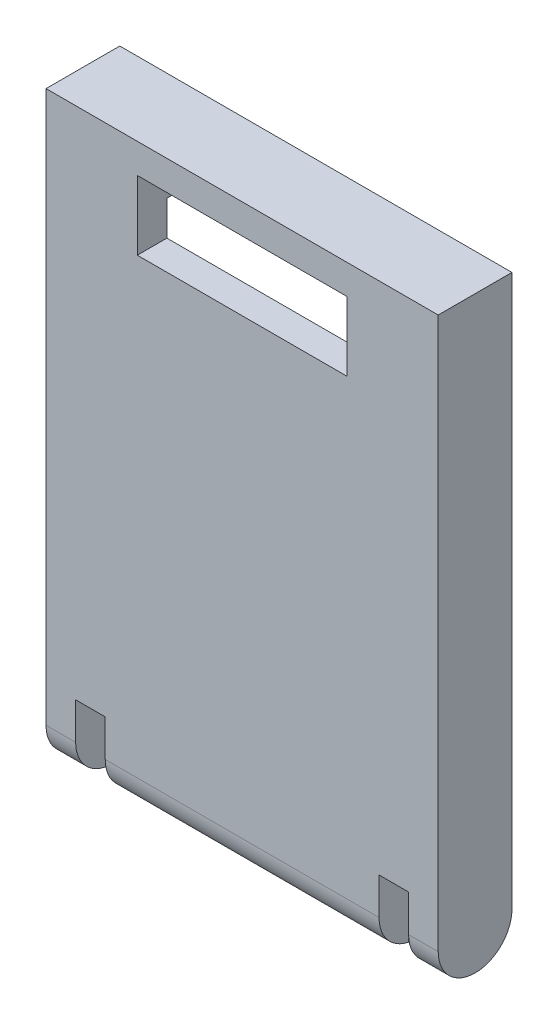
from build123d import *

# Parameters (mm, degrees)
BOSS_EXTRUDE1_DEPTH     = 15.9
SHELL1_START            = -14.7
SHELL1_DEPTH            = 13.5
CUT_EXTRUDE1_DEPTH      = 29.819656487
CUT_EXTRUDE1_DEPTH_BACK = 29.819656487
SKETCH3_W               = 8.5
SKETCH3_H               = 2.8
CUT_EXTRUDE2_START      = -1.2
CUT_EXTRUDE2_DEPTH      = 1.2
LPATTERN1_COUNT         = 2
LPATTERN1_PITCH         = 12.3
SKETCH5_W               = 11.1
SKETCH5_H               = 2.99
CUT_EXTRUDE5_DEPTH      = 0.8
SKETCH6_W               = 8.7
SKETCH6_H               = 0.59
BOSS_EXTRUDE2_DEPTH     = 1.1
SKETCH7_W               = 11.1
SKETCH7_H               = 1.1
CUT_EXTRUDE6_DEPTH      = 0.17
SKETCH8_W               = 0.5
SKETCH8_H               = 1.4
BOSS_EXTRUDE3_DEPTH     = 2.5
LPATTERN2_COUNT         = 2
LPATTERN2_PITCH         = 9


# Read off the part's stored shape, not the designer's step: Shell1
with BuildPart() as part:
    # Sketch2 → Boss-Extrude1 (new body)
    with BuildSketch(Plane(origin=(0, 0, 0), x_dir=(0, 0, -1), z_dir=(1, 0, 0))):
        with BuildLine():
            Line((-1.495, 0), (1.495, 0))
            Line((1.495, 0), (1.495, -22.355))
            ThreePointArc((1.495, -22.355), (0, -23.85), (-1.495, -22.355))
            Line((-1.495, -22.355), (-1.495, 0))
        make_face()
    extrude(amount=-BOSS_EXTRUDE1_DEPTH)

    # Shell1 outline → Shell1 (cut)
    with BuildSketch(Plane.YZ.offset(SHELL1_START)):
        with BuildLine():
            Line((-22.355, -0.295), (-22.355, -1.495))
            Line((-22.355, -1.495), (-1.2, -1.495))
            Line((-1.2, -1.495), (-1.2, 0.295))
            Line((-1.2, 0.295), (-22.355, 0.295))
            ThreePointArc((-22.355, 0.295), (-22.65, 0), (-22.355, -0.295))
        make_face()
    extrude(amount=SHELL1_DEPTH, mode=Mode.SUBTRACT)

    # Sketch3 → Cut-Extrude1 (cut, two sides: drawn at the far end of the back side and taken through both)
    with BuildSketch(Plane.XY.offset(1.495).offset(-CUT_EXTRUDE1_DEPTH_BACK)):
        with Locations((-7.95, -2.6)):
            Rectangle(SKETCH3_W, SKETCH3_H)
    extrude(amount=CUT_EXTRUDE1_DEPTH + CUT_EXTRUDE1_DEPTH_BACK, mode=Mode.SUBTRACT)

    # Sketch4 → Cut-Extrude2 (cut)
    with BuildSketch(Plane.ZY.offset(14.7).offset(CUT_EXTRUDE2_START)):
        with BuildLine():
            Line((1.495, -20.86), (-1.495, -20.86))
            Line((-1.495, -20.86), (-1.495, -22.355))
            ThreePointArc((-1.495, -22.355), (0, -23.85), (1.495, -22.355))
            Line((1.495, -22.355), (1.495, -20.86))
        make_face()
    cut_extrude2 = extrude(amount=CUT_EXTRUDE2_DEPTH, mode=Mode.SUBTRACT)

    # LPattern1: Cut-Extrude2 ×2
    with Locations(*[(i * LPATTERN1_PITCH, 0, 0) for i in range(1, LPATTERN1_COUNT)]):
        add(cut_extrude2, mode=Mode.SUBTRACT)

    # Sketch5 → Cut-Extrude5 (cut)
    with BuildSketch(Plane(origin=(0, 0, -1.495), x_dir=(-1, 0, 0), z_dir=(0, 0, -1))):
        with Locations((7.95, -22.355)):
            Rectangle(SKETCH5_W, SKETCH5_H)
    extrude(amount=-CUT_EXTRUDE5_DEPTH, mode=Mode.SUBTRACT)

    # Sketch6 → Boss-Extrude2 (add)
    with BuildSketch(Plane(origin=(0, 0, 0.295), x_dir=(-1, 0, 0), z_dir=(0, 0, -1))):
        Polygon((2.4, -20.86), (13.5, -20.86), (13.5, -23.85), (12.3, -23.85), (3.6, -23.85), (2.4, -23.85), align=None)
        with Locations((7.95, -22.355)):
            Rectangle(SKETCH6_W, SKETCH6_H, mode=Mode.SUBTRACT)
    extrude(amount=BOSS_EXTRUDE2_DEPTH)

    # Sketch7 → Cut-Extrude6 (cut)
    with BuildSketch(Plane.XZ.offset(23.85)):
        with Locations((-7.95, -0.255)):
            Rectangle(SKETCH7_W, SKETCH7_H)
    extrude(amount=-CUT_EXTRUDE6_DEPTH, mode=Mode.SUBTRACT)

    # Sketch8 → Boss-Extrude3 (add)
    with BuildSketch(Plane(origin=(0, 0, 0.295), x_dir=(-1, 0, 0), z_dir=(0, 0, -1))):
        with Locations((3.45, -1.9)):
            Rectangle(SKETCH8_W, SKETCH8_H)
    boss_extrude3 = extrude(amount=BOSS_EXTRUDE3_DEPTH)

    # LPattern2: Boss-Extrude3 ×2
    with Locations(*[(-i * LPATTERN2_PITCH, 0, 0) for i in range(1, LPATTERN2_COUNT)]):
        add(boss_extrude3)


solid = part.part
